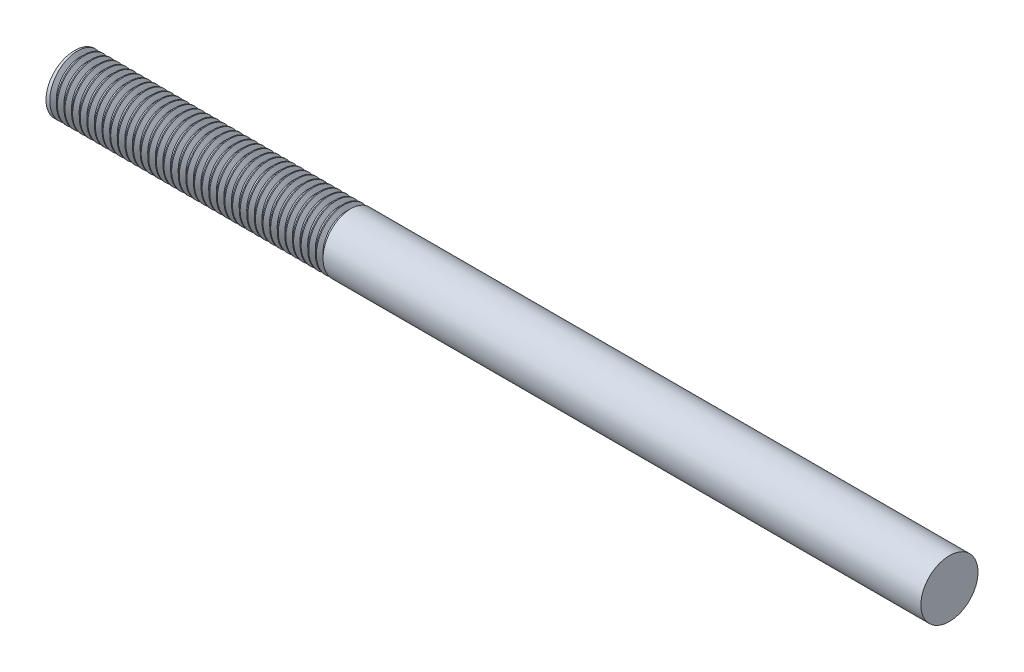
from build123d import *
from build123d.topology import SkipClean

# Parameters (mm, degrees)
THREAD1_PITCH = 1.058333333


with BuildPart() as part:
    # Sketch1 → Revolve1 (revolve)
    with BuildSketch(Plane.XY):
        Polygon((76.065994701, 26.318412015), (76.065994701, 22.635412015), (-45.488023557, 22.635412015), (-45.488023557, 26.604162015), (76.065994701, 26.604162015), align=None)
        Polygon((76.065994701, 22.635412015), (76.065994701, 26.318412015), (76.065994701, 26.604162015), (-45.488023557, 26.604162015), (-45.488023557, 22.635412015), align=None)
    revolve(axis=Axis((76.065994701, 22.635412015, 0), (-1, 0, 0)))

    # Thread1: arcs per turn and ends read off the stored shape
    # Thread1: the profile of Thread Profile1 profile screwed along a right-hand helix through 36 turns, 8 arcs to a turn; built about Z, then put on its axis
    with SkipClean():  # the faces are left unmerged after this step: merging them gives an invalid solid
        thread1_z = Axis((0, 0, 0), (0, 0, 1))
        thread1_corners = [(3.96905, 0, -0.000173205), (3.96905, 0, 0.926214869), (3.395910282, 0, 0.595312499), (3.395910282, 0, 0.330729165)]
        with BuildLine(mode=Mode.PRIVATE) as thread1_profile:
            Line(thread1_corners[0], thread1_corners[1])
            Line(thread1_corners[1], thread1_corners[2])
            Line(thread1_corners[2], thread1_corners[3])
            Line(thread1_corners[3], thread1_corners[0])
        thread1_cap = Face(thread1_profile.wire())
        thread1_turn_angles = [0, 22.5, 45, 67.5, 90, 112.5, 135, 157.5, 180, 202.5, 225, 247.5, 270, 292.5, 315, 337.5, 360]
        thread1_turn_weights = [1, 0.9238795325112867, 1, 0.9238795325112867, 1, 0.9238795325112867, 1, 0.9238795325112867, 1, 0.9238795325112867, 1, 0.9238795325112867, 1, 0.9238795325112867, 1, 0.9238795325112867, 1]
        thread1_turn_rails = [Edge.make_bspline([Vector(p[0], p[1], 0).rotate(thread1_z, thread1_turn_angles[k]) / thread1_turn_weights[k] + Vector(0, 0, p[2] + THREAD1_PITCH * thread1_turn_angles[k] / 360) for k in range(17)], [0, 0, 0, 1, 1, 2, 2, 3, 3, 4, 4, 5, 5, 6, 6, 7, 7, 8, 8, 8], 2, thread1_turn_weights) for p in thread1_corners]
        thread1_turn_sides = [Face.make_surface_from_curves(thread1_turn_rails[p[0]], thread1_turn_rails[p[1]]) for p in [(0, 1), (1, 2), (2, 3), (3, 0)]]
        thread1 = Plane(origin=(-45.488023557, 22.635412015, 0), x_dir=(0, 0, -1), z_dir=(1, 0, 0)) * Solid(Shell([*[p.moved(Location((0, 0, THREAD1_PITCH * i))) for i in range(36) for p in thread1_turn_sides], thread1_cap, thread1_cap.rotate(thread1_z, 12960).moved(Location((0, 0, THREAD1_PITCH * 12960 / 360)))]))
        add(thread1, mode=Mode.SUBTRACT)


solid = part.part
